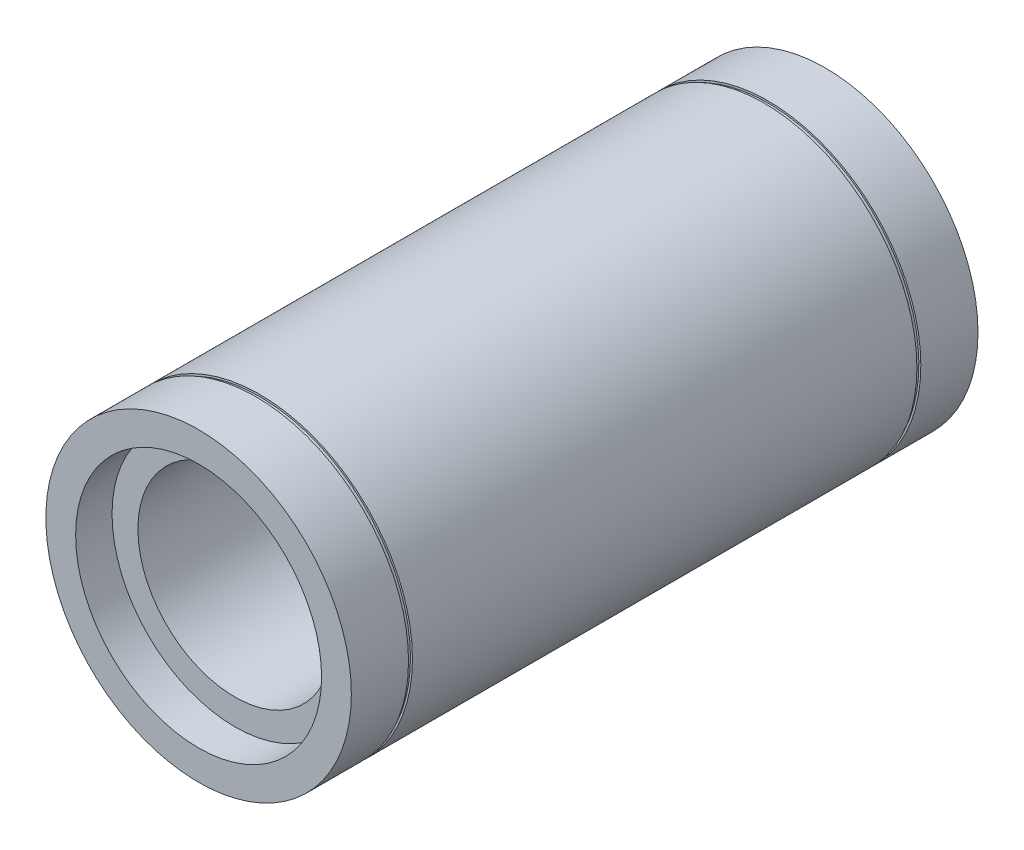
from build123d import *

# Parameters (mm, degrees)
SKETCH1_R           = 3.9
SKETCH1_R_2         = 2.48
BOSS_EXTRUDE1_DEPTH = 16
CUT_EXTRUDE1_START  = -0.93
SKETCH2_R           = 3.14
SKETCH2_R_2         = 2.48
CUT_EXTRUDE1_DEPTH  = 0.93
SKETCH3_R           = 3.14
SKETCH3_R_2         = 2.48
CUT_EXTRUDE3_DEPTH  = 0.93
SKETCH4_R           = 0.93
WRAP1_START         = 1.46
WRAP1_DEPTH         = 0.1
WRAP1_START_2       = 14.44
WRAP1_2_DEPTH       = 0.1


# Read off the part's stored shape, not the designer's step: Wrap1
with BuildPart() as part:
    # Sketch1 → Boss-Extrude1 (new body)
    with BuildSketch(Plane.XY):
        Circle(SKETCH1_R)
        Circle(SKETCH1_R_2, mode=Mode.SUBTRACT)
    extrude(amount=BOSS_EXTRUDE1_DEPTH)

    # Sketch2 → Cut-Extrude1 (cut)
    with BuildSketch(Plane.XY.offset(16).offset(CUT_EXTRUDE1_START)):
        Circle(SKETCH2_R)
        Circle(SKETCH2_R_2, mode=Mode.SUBTRACT)
    extrude(amount=CUT_EXTRUDE1_DEPTH, mode=Mode.SUBTRACT)

    # Sketch3 → Cut-Extrude3 (cut)
    with BuildSketch(Plane.XY):
        Circle(SKETCH3_R)
        Circle(SKETCH3_R_2, mode=Mode.SUBTRACT)
    extrude(amount=CUT_EXTRUDE3_DEPTH, mode=Mode.SUBTRACT)

    # Sketch4 → Cut-Revolve1 (revolve, cut)
    with BuildSketch(Plane(origin=(0, 0, 0), x_dir=(1, 0, 0), z_dir=(0, 1, 0)), mode=Mode.PRIVATE) as cut_revolve1_sk:
        with Locations((2.48, -8)):
            Circle(SKETCH4_R)
    revolve(cut_revolve1_sk.sketch.rotate(Axis((0, 0, 0.93), (0, 0, 1)), 180), axis=Axis((0, 0, 0.93), (0, 0, 1)), mode=Mode.SUBTRACT)

    # Wrap1 outline → Wrap1 (cut)
    with BuildSketch(Plane.XY.offset(WRAP1_START)):
        with BuildLine():
            Line((-2.107178993, -3.281736841), (-2.080163878, -3.239663292))
            ThreePointArc((-2.080163878, -3.239663292), (2.078325496, 3.240842967), (-2.076488681, -3.242020166))
            Line((-2.076488681, -3.242020166), (-2.103456067, -3.284124324))
            ThreePointArc((-2.103456067, -3.284124324), (2.105317868, 3.28293111), (-2.107178993, -3.281736841))
        make_face()
    extrude(amount=WRAP1_DEPTH, mode=Mode.SUBTRACT)

    # Wrap1 2 outline → Wrap1 2 (cut)
    with BuildSketch(Plane.XY.offset(WRAP1_START_2)):
        with BuildLine():
            Line((-2.107178993, -3.281736841), (-2.080163878, -3.239663292))
            ThreePointArc((-2.080163878, -3.239663292), (2.078325496, 3.240842967), (-2.076488681, -3.242020166))
            Line((-2.076488681, -3.242020166), (-2.103456067, -3.284124324))
            ThreePointArc((-2.103456067, -3.284124324), (2.105317868, 3.28293111), (-2.107178993, -3.281736841))
        make_face()
    extrude(amount=WRAP1_2_DEPTH, mode=Mode.SUBTRACT)


solid = part.part
